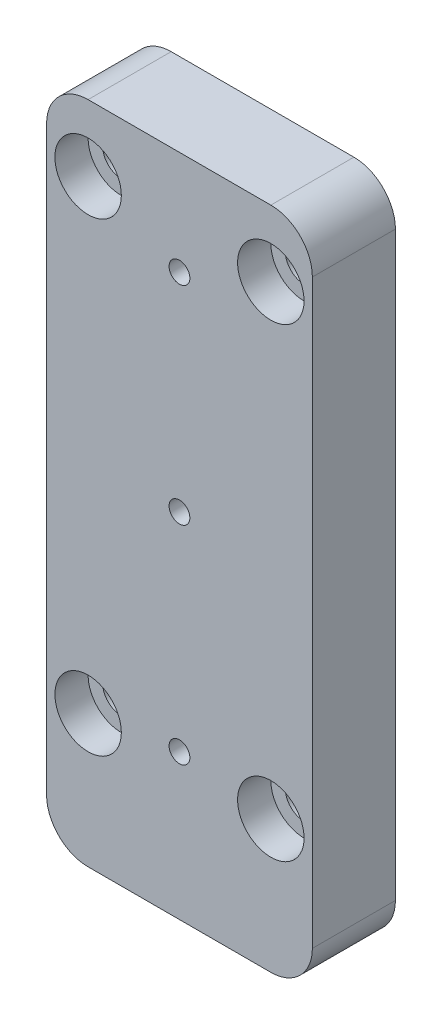
from build123d import *

# Parameters (mm, degrees)
ESQUISSE1_W                  = 32
ESQUISSE1_H                  = 80
BOSS_EXTRU_1_DEPTH           = 10
ENL_V_MAT_EXTRU_1_DEPTH      = 87.740993769
ENL_V_MAT_EXTRU_1_DEPTH_BACK = 87.740993769
ESQUISSE2_R                  = 1.25
ENL_V_MAT_EXTRU_2_DEPTH      = 87.740993769
ENL_V_MAT_EXTRU_2_DEPTH_BACK = 87.740993769
ESQUISSE3_R                  = 2.25
ESQUISSE4_R                  = 4
ENL_V_MAT_EXTRU_3_DEPTH      = 4
CONG_1_R                     = 5


with BuildPart() as part:
    # Esquisse1 → Boss.-Extru.1 (new body)
    with BuildSketch(Plane.XY):
        with Locations((16, 40)):
            Rectangle(ESQUISSE1_W, ESQUISSE1_H)
    extrude(amount=BOSS_EXTRU_1_DEPTH)

    # Esquisse2 → Enlèv. mat.-Extru.1 (cut, two sides: drawn at the far end of the back side and taken through both)
    with BuildSketch(Plane.XY.offset(10).offset(-ENL_V_MAT_EXTRU_1_DEPTH_BACK)):
        with Locations((16, 17.5)):
            Circle(ESQUISSE2_R)
        with Locations((16, 42.5)):
            Circle(ESQUISSE2_R)
        with Locations((16, 67.5)):
            Circle(ESQUISSE2_R)
        with Locations((16, 92.5)):
            Circle(ESQUISSE2_R)
        with Locations((16, 117.5)):
            Circle(ESQUISSE2_R)
        with Locations((16, 142.5)):
            Circle(ESQUISSE2_R)
        with Locations((16, 167.5)):
            Circle(ESQUISSE2_R)
        with Locations((16, 192.5)):
            Circle(ESQUISSE2_R)
    extrude(amount=ENL_V_MAT_EXTRU_1_DEPTH + ENL_V_MAT_EXTRU_1_DEPTH_BACK, mode=Mode.SUBTRACT)

    # Esquisse3 → Enlèv. mat.-Extru.2 (cut, two sides: drawn at the far end of the back side and taken through both)
    with BuildSketch(Plane.XY.offset(10).offset(-ENL_V_MAT_EXTRU_2_DEPTH_BACK)):
        with Locations((5, 16)):
            Circle(ESQUISSE3_R)
        with Locations((27, 16)):
            Circle(ESQUISSE3_R)
        with Locations((27, 72)):
            Circle(ESQUISSE3_R)
        with Locations((5, 72)):
            Circle(ESQUISSE3_R)
    extrude(amount=ENL_V_MAT_EXTRU_2_DEPTH + ENL_V_MAT_EXTRU_2_DEPTH_BACK, mode=Mode.SUBTRACT)

    # Esquisse4 → Enlèv. mat.-Extru.3 (cut)
    with BuildSketch(Plane.XY.offset(10)):
        with Locations((5, 16)):
            Circle(ESQUISSE4_R)
        with Locations((27, 16)):
            Circle(ESQUISSE4_R)
        with Locations((5, 72)):
            Circle(ESQUISSE4_R)
        with Locations((27, 72)):
            Circle(ESQUISSE4_R)
    extrude(amount=-ENL_V_MAT_EXTRU_3_DEPTH, mode=Mode.SUBTRACT)

    # Congé1
    cong_1_edges = [part.edges().sort_by_distance(p)[0] for p in [
        (0, 80, 5),
        (32, 80, 5),
        (32, 0, 5),
        (0, 0, 5),
    ]]
    fillet(cong_1_edges, radius=CONG_1_R)


solid = part.part
